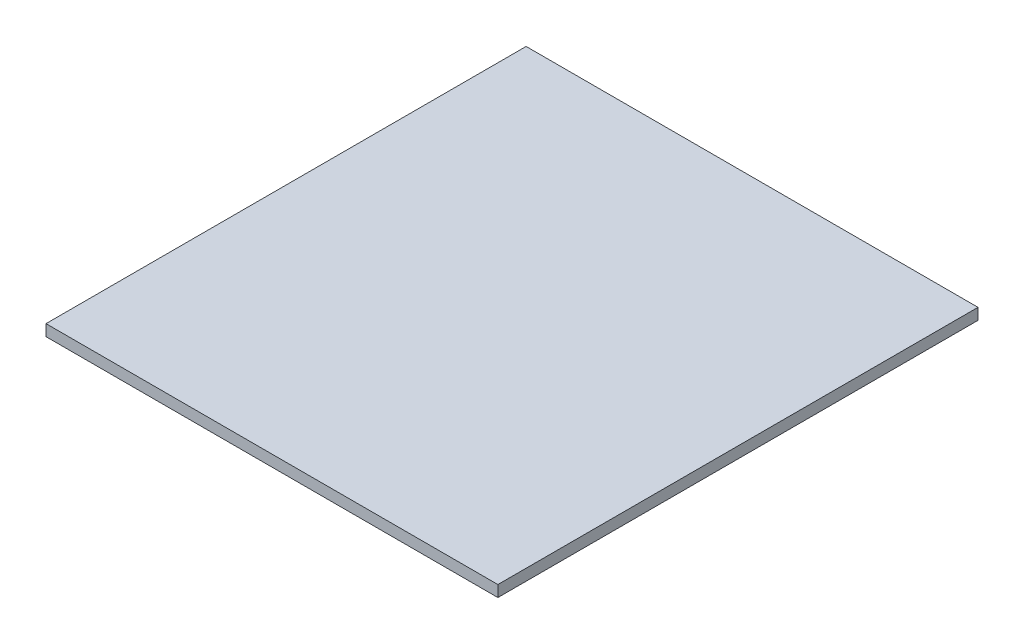
from build123d import *

# Parameters (mm, degrees)
SKETCH_1_W             = 800
SKETCH_1_H             = 850
SM_BASE_FLANGE_1_DEPTH = 20


# Sheet-metal steps are written as plain solids
with BuildPart() as part:
    # Sketch 1 → Базовая кромка1 (new body)
    with BuildSketch(Plane(origin=(0, 0, 0), x_dir=(1, 0, 0), z_dir=(0, 1, 0))):
        with Locations((341.577466865, -385.166454681)):
            Rectangle(SKETCH_1_W, SKETCH_1_H)
    extrude(amount=-SM_BASE_FLANGE_1_DEPTH)


solid = part.part
